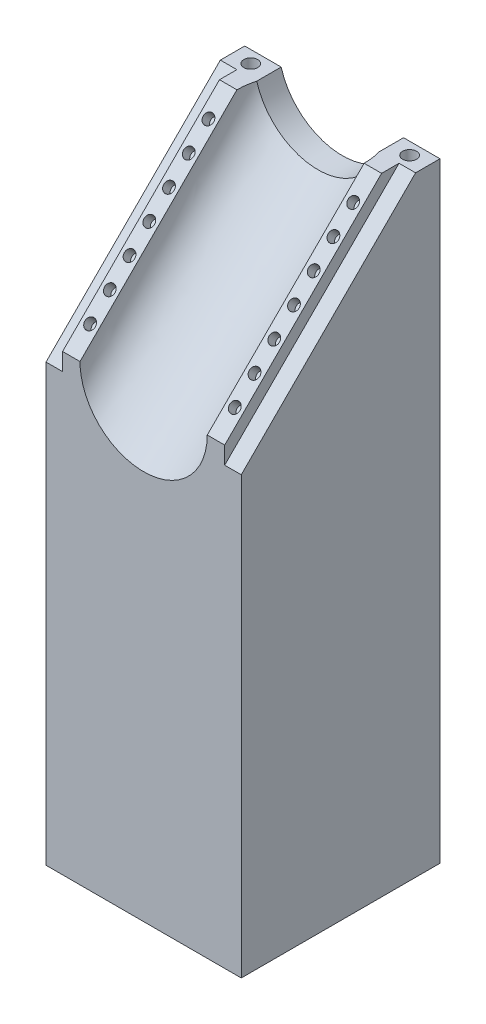
from build123d import *

# Parameters (mm, degrees)
SKETCH1_W           = 56
SKETCH1_H           = 175
BOSS_EXTRUDE1_DEPTH = 50
CUT_SWEEP1_START    = -28
CUT_SWEEP1_DEPTH    = 56
CUT_SWEEP1_2_DEPTH  = 4.75
CUT_SWEEP1_START_2  = 23.25
CUT_SWEEP1_3_DEPTH  = 4.75
CUT_SWEEP1_START_3  = -127.279220614
CUT_SWEEP1_4_DEPTH  = 159.099025767
SKETCH5_W           = 7
SKETCH5_H           = 175
BOSS_EXTRUDE2_DEPTH = 56
CUT_EXTRUDE1_DEPTH  = 7
SKETCH21_R          = 1.5
CUT_EXTRUDE3_DEPTH  = 3
SKETCH22_R          = 2
CUT_EXTRUDE4_DEPTH  = 10


with BuildPart() as part:
    # Sketch1 → Boss-Extrude1 (new body)
    with BuildSketch(Plane.XY):
        with Locations((0, -42.5)):
            Rectangle(SKETCH1_W, SKETCH1_H)
    extrude(amount=BOSS_EXTRUDE1_DEPTH)

    # Cut-Sweep1: read off the stored shape, not the designer's step
    # Cut-Sweep1 outline → Cut-Sweep1 (cut)
    with BuildSketch(Plane.YZ.offset(CUT_SWEEP1_START)):
        Polygon((0, 50), (45, 5), (45, 50), align=None)
    extrude(amount=CUT_SWEEP1_DEPTH, mode=Mode.SUBTRACT)

    # Cut-Sweep1 2 outline → Cut-Sweep1 2 (cut)
    with BuildSketch(Plane.YZ.offset(CUT_SWEEP1_START)):
        Polygon((45, 0), (45, 5), (0, 50), (-5, 50), align=None)
    extrude(amount=CUT_SWEEP1_2_DEPTH, mode=Mode.SUBTRACT)

    # Cut-Sweep1 3 outline → Cut-Sweep1 3 (cut)
    with BuildSketch(Plane.YZ.offset(CUT_SWEEP1_START_2)):
        Polygon((45, 0), (45, 5), (0, 50), (-5, 50), align=None)
    extrude(amount=CUT_SWEEP1_3_DEPTH, mode=Mode.SUBTRACT)

    # Cut-Sweep1 4 outline → Cut-Sweep1 4 (cut)
    with BuildSketch(Plane(origin=(0, 0, 0), x_dir=(1, 0, 0), z_dir=(0, 0.7071067811865486, -0.7071067811865466)).offset(CUT_SWEEP1_START_3)):
        with BuildLine():
            add(Edge.make_bspline(
                [(-18.25, -35.355339059), (-18.25, -9.545941546), (18.25, -9.545941546), (18.25, -35.355339059)],
                knots=[0, 0, 0, 0, 1, 1, 1, 1], degree=3, weights=[1, 0.333333333, 0.333333333, 1]))
            Line((-18.25, -35.355339059), (18.25, -35.355339059))
        make_face()
    extrude(amount=CUT_SWEEP1_4_DEPTH, mode=Mode.SUBTRACT)

    # Sketch5 → Boss-Extrude2 (add)
    with BuildSketch(Plane(origin=(28, 0, 0), x_dir=(0, 0, -1), z_dir=(1, 0, 0))):
        with Locations((3.5, -42.5)):
            Rectangle(SKETCH5_W, SKETCH5_H)
    extrude(amount=-BOSS_EXTRUDE2_DEPTH)

    # Sketch18 → Cut-Extrude1 (cut)
    with BuildSketch(Plane.XY):
        with BuildLine():
            Line((-17.551709318, 45), (17.551709318, 45))
            ThreePointArc((17.551709318, 45), (0, 31.75), (-17.551709318, 45))
        make_face()
    extrude(amount=-CUT_EXTRUDE1_DEPTH, mode=Mode.SUBTRACT)

    # Sketch21 → Cut-Extrude3 (cut)
    with BuildSketch(Plane(origin=(0, 25, 25), x_dir=(1, 0, 0), z_dir=(0, 0.7071067811865465, 0.7071067811865486))):
        with Locations(Location((-20.75, 20.284271247, 0), (0, 0, 270))):
            Circle(SKETCH21_R)
        with Locations(Location((20.75, 20.284271247, 0), (0, 0, 270))):
            Circle(SKETCH21_R)
        with Locations(Location((20.75, 12.284271247, 0), (0, 0, 270))):
            Circle(SKETCH21_R)
        with Locations(Location((20.75, 4.284271247, 0), (0, 0, 270))):
            Circle(SKETCH21_R)
        with Locations(Location((20.75, -3.715728753, 0), (0, 0, 270))):
            Circle(SKETCH21_R)
        with Locations(Location((20.75, -11.715728753, 0), (0, 0, 270))):
            Circle(SKETCH21_R)
        with Locations(Location((20.75, -19.715728753, 0), (0, 0, 270))):
            Circle(SKETCH21_R)
        with Locations(Location((20.75, -27.715728753, 0), (0, 0, 270))):
            Circle(SKETCH21_R)
        with Locations(Location((-20.75, 12.284271247, 0), (0, 0, 270))):
            Circle(SKETCH21_R)
        with Locations(Location((-20.75, 4.284271247, 0), (0, 0, 270))):
            Circle(SKETCH21_R)
        with Locations(Location((-20.75, -3.715728753, 0), (0, 0, 270))):
            Circle(SKETCH21_R)
        with Locations(Location((-20.75, -11.715728753, 0), (0, 0, 270))):
            Circle(SKETCH21_R)
        with Locations(Location((-20.75, -19.715728753, 0), (0, 0, 270))):
            Circle(SKETCH21_R)
        with Locations(Location((-20.75, -27.715728753, 0), (0, 0, 270))):
            Circle(SKETCH21_R)
    extrude(amount=-CUT_EXTRUDE3_DEPTH, mode=Mode.SUBTRACT)

    # Sketch22 → Cut-Extrude4 (cut)
    with BuildSketch(Plane(origin=(0, 45, 0), x_dir=(1, 0, 0), z_dir=(0, 1, 0))):
        with Locations(Location((-22.775854659, 3.5, 0), (0, 0, 270))):
            Circle(SKETCH22_R)
        with Locations(Location((22.775854659, 3.5, 0), (0, 0, 270))):
            Circle(SKETCH22_R)
    extrude(amount=-CUT_EXTRUDE4_DEPTH, mode=Mode.SUBTRACT)


solid = part.part
